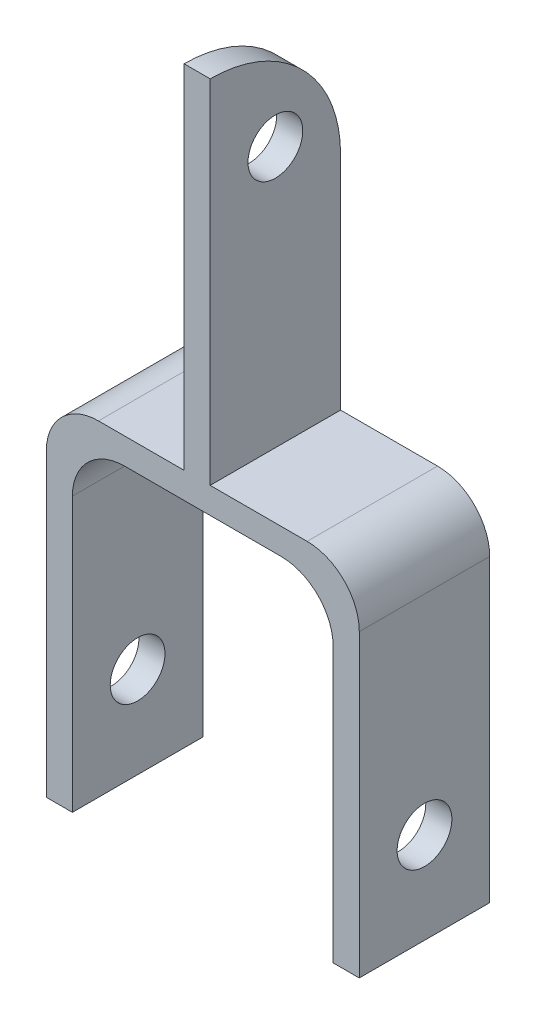
from build123d import *

# Parameters (mm, degrees)
BOSS_EXTRUDE1_DEPTH      = 12.7
F_0000_CLEARANCE_HOLE1_D = 5.334
FILLET1_R                = 5.08
FILLET2_R                = 12.7


with BuildPart() as part:
    # Sketch1 → Boss-Extrude1 (new body)
    with BuildSketch(Plane.XY):
        Polygon((0, 0), (2.54, 0), (2.54, 31.75), (27.94, 31.75), (27.94, 0), (30.48, 0), (30.48, 34.29), (15.957826087, 34.29), (15.957826087, 68.58), (13.417826087, 68.58), (13.417826087, 34.29), (0, 34.29), align=None)
    extrude(amount=BOSS_EXTRUDE1_DEPTH)

    # #0000 Clearance Hole1 (through all)
    with Locations(Plane(origin=(0, 0, 0), x_dir=(0, 0, -1), z_dir=(-1, 0, 0))):
        with Locations((-6.35, -59.69), (-6.35, -8.89)):
            Hole(F_0000_CLEARANCE_HOLE1_D / 2)

    # Fillet1
    fillet1_edges = [part.edges().sort_by_distance(p)[0] for p in [
        (0, 34.29, 6.35),
        (30.48, 34.29, 6.35),
        (27.94, 31.75, 6.35),
        (2.54, 31.75, 6.35),
    ]]
    fillet(fillet1_edges, radius=FILLET1_R)

    # Fillet2
    fillet2_edges = [part.edges().sort_by_distance(p)[0] for p in [
        (14.687826087, 68.58, 0),
    ]]
    fillet(fillet2_edges, radius=FILLET2_R - 0.0001)  # a hair under: the kernel refuses the full size


solid = part.part
